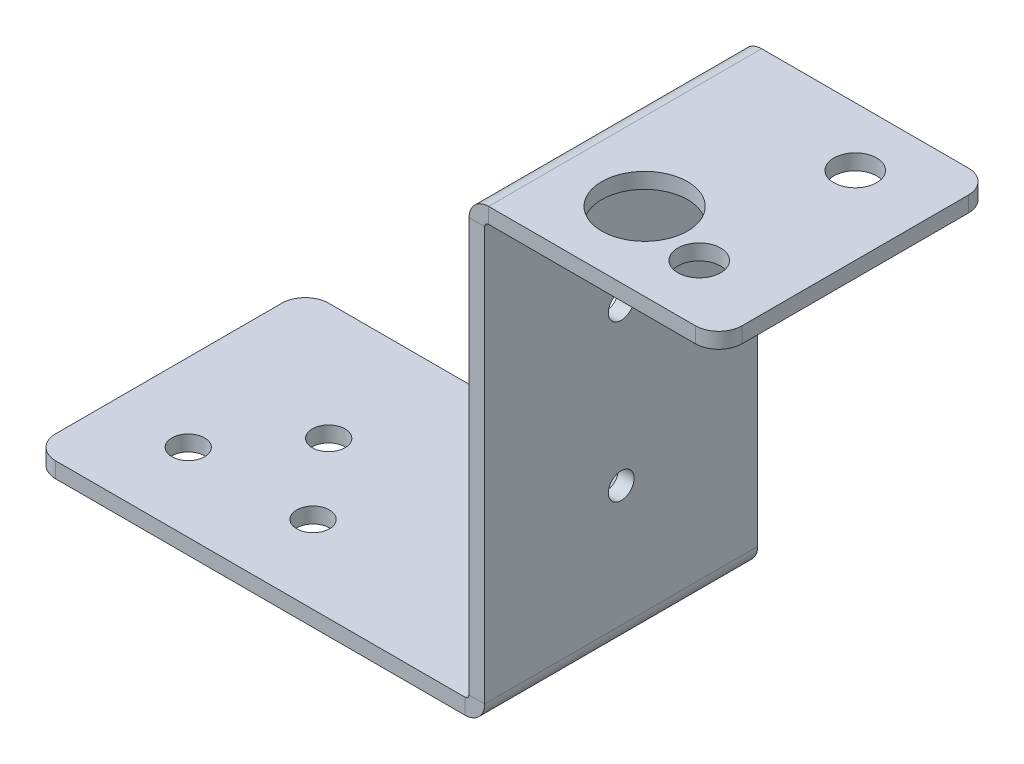
from build123d import *

# Parameters (mm, degrees)
EXTRUDE_1_DEPTH               = 35
FILLET_1_R                    = 3
CUT_EXTRUDE_2_DEPTH           = 310.2026821
CUT_EXTRUDE_2_DEPTH_BACK      = 310.2026821
SKETCH_5_R                    = 2.1
SKETCH_5_R_2                  = 5.5
SKETCH_5_R_3                  = 2.75
SKETCH_6_R                    = 1.65
CUT_EXTRUDE_3_DEPTH           = 35
SHEET_START                   = -667.695268107
SHEET_METAL_1_OUTLINE_R       = 2.75
SHEET_METAL_1_OUTLINE_R_2     = 5.5
SHEET_METAL_1_DEPTH           = 56
SHEET_START_2                 = -669.695268107
SHEET_METAL_1_2_OUTLINE_R     = 1.65
SHEET_METAL_1_2_OUTLINE_R_2   = 2.75
SHEET_METAL_1_2_OUTLINE_R_3   = 5.5
SHEET_METAL_1_2_DEPTH         = 2
SHEET_METAL_1_3_OUTLINE_R     = 1.65
SHEET_METAL_1_3_OUTLINE_R_2   = 2.75
SHEET_METAL_1_3_OUTLINE_R_3   = 5.5
SHEET_METAL_1_3_DEPTH         = 2
SHEET_START_3                 = -650.045268007
SHEET_METAL_1_3_2_OUTLINE_W   = 2
SHEET_METAL_1_3_2_OUTLINE_H   = 35
SHEET_METAL_1_3_2_DEPTH       = 16.6999998
SHEET_START_4                 = -630.045268007
SHEET_METAL_1_3_3_OUTLINE_W   = 2
SHEET_METAL_1_3_3_OUTLINE_H   = 35
SHEET_METAL_1_3_3_DEPTH       = 15.8499999
SHEET_START_5                 = -667.459318107
SHEET_METAL_1_3_4_OUTLINE_W   = 2
SHEET_METAL_1_3_4_OUTLINE_H   = 35
SHEET_METAL_1_3_4_DEPTH       = 14.1140499
SHEET_START_6                 = -613.695268107
SHEET_METAL_1_3_5_OUTLINE_R   = 1.65
SHEET_METAL_1_3_5_DEPTH       = 2
SHEET_START_7                 = -614.195268107
SHEET_METAL_1_3_6_OUTLINE_R   = 5.5
SHEET_METAL_1_3_6_OUTLINE_R_2 = 2.75
SHEET_METAL_1_3_6_OUTLINE_R_3 = 1.65
SHEET_METAL_1_3_6_DEPTH       = 2.5
SHEET_START_8                 = -653.345268207
SHEET_METAL_1_3_7_OUTLINE_W   = 2
SHEET_METAL_1_3_7_OUTLINE_H   = 35
SHEET_METAL_1_3_7_DEPTH       = 23.3000002
SHEET_METAL_1_3_8_OUTLINE_W   = 2
SHEET_METAL_1_3_8_OUTLINE_H   = 35
SHEET_METAL_1_3_8_DEPTH       = 0.23595
SHEET_START_9                 = -35
SHEET_METAL_1_3_9_DEPTH       = 35
SHEET_START_10                = 269.690733397
SHEET_METAL_1_3_10_OUTLINE_R  = 1.65
SHEET_METAL_1_3_10_DEPTH      = 2
SHEET_METAL_1_3_11_DEPTH      = 35


with BuildPart() as part:
    # Sketch 2 → 凸台-拉伸1 (new body)
    with BuildSketch(Plane.XY):
        with BuildLine():
            Line((298.690733397, -611.695268107), (272.190733397, -611.695268107))
            ThreePointArc((272.190733397, -611.695268107), (270.422966444, -612.427501154), (269.690733397, -614.195268107))
            Line((269.690733397, -614.195268107), (269.690733397, -667.195268107))
            ThreePointArc((269.690733397, -667.195268107), (269.544286788, -667.548821498), (269.190733397, -667.695268107))
            Line((269.190733397, -667.695268107), (216.690733397, -667.695268107))
            Line((216.690733397, -667.695268107), (213.690733397, -667.695268107))
            Line((213.690733397, -667.695268107), (213.690733397, -669.695268107))
            Line((213.690733397, -669.695268107), (216.690733397, -669.695268107))
            Line((216.690733397, -669.695268107), (269.190733397, -669.695268107))
            ThreePointArc((269.190733397, -669.695268107), (270.95850035, -668.96303506), (271.690733397, -667.195268107))
            Line((271.690733397, -667.195268107), (271.690733397, -614.195268107))
            ThreePointArc((271.690733397, -614.195268107), (271.837180006, -613.841714717), (272.190733397, -613.695268107))
            Line((272.190733397, -613.695268107), (298.690733397, -613.695268107))
            Line((298.690733397, -613.695268107), (301.690733397, -613.695268107))
            Line((301.690733397, -613.695268107), (301.690733397, -611.695268107))
            Line((301.690733397, -611.695268107), (298.690733397, -611.695268107))
        make_face()
    extrude(amount=-EXTRUDE_1_DEPTH)

    # 圆角1
    fillet_1_edges = [part.edges().sort_by_distance(p)[0] for p in [
        (301.690733397, -612.695268107, -35),
        (213.690733397, -668.695268107, 0),
        (301.690733397, -612.695268107, 0),
        (213.690733397, -668.695268107, -35),
    ]]
    fillet(fillet_1_edges, radius=FILLET_1_R)

    # 草图5 → 切除-拉伸2 (cut, two sides: drawn at the far end of the back side and taken through both)
    with BuildSketch(Plane.XZ.offset(669.695268107).offset(-CUT_EXTRUDE_2_DEPTH_BACK)):
        with Locations(Location((223.690733397, -10, 0), (0, 0, 270))):
            Circle(SKETCH_5_R)
        with Locations(Location((239.690733397, -10, 0), (0, 0, 270))):
            Circle(SKETCH_5_R)
        with Locations(Location((231.690733397, -20, 0), (0, 0, 270))):
            Circle(SKETCH_5_R)
        with Locations(Location((282.190733397, -10, 0), (0, 0, 270))):
            Circle(SKETCH_5_R_2)
        with Locations(Location((291.690733397, -7.5, 0), (0, 0, 270))):
            Circle(SKETCH_5_R_3)
        with Locations(Location((291.690733397, -27.5, 0), (0, 0, 270))):
            Circle(SKETCH_5_R_3)
    extrude(amount=CUT_EXTRUDE_2_DEPTH + CUT_EXTRUDE_2_DEPTH_BACK, mode=Mode.SUBTRACT)

    # 草图6 → 切除-拉伸3 (cut)
    with BuildSketch(Plane.ZY.offset(-269.690733397)):
        with Locations(Location((-17.5, -651.695268107, 0), (0, 0, 270))):
            Circle(SKETCH_6_R)
        with Locations(Location((-17.5, -631.695268107, 0), (0, 0, 270))):
            Circle(SKETCH_6_R)
    extrude(amount=-CUT_EXTRUDE_3_DEPTH, mode=Mode.SUBTRACT)

    # Sheet Metal 1: read off the stored shape, not the designer's step
    # Sheet Metal 1 outline → Sheet Metal 1 (cut)
    with BuildSketch(Plane(origin=(0, 0, 0), x_dir=(1, 0, 0), z_dir=(0, 1, 0)).offset(SHEET_START)):
        with BuildLine():
            ThreePointArc((298.690733397, 0), (300.812053741, 0.878679656), (301.690733397, 3))
            Line((301.690733397, 3), (301.690733397, 32))
            ThreePointArc((301.690733397, 32), (300.812053741, 34.121320344), (298.690733397, 35))
            Line((298.690733397, 35), (269.190733397, 35))
            Line((269.190733397, 35), (269.190733397, 0))
            Line((269.190733397, 0), (298.690733397, 0))
        make_face()
        with Locations((291.690733397, 7.5)):
            Circle(SHEET_METAL_1_OUTLINE_R, mode=Mode.SUBTRACT)
        with Locations((282.190733397, 10)):
            Circle(SHEET_METAL_1_OUTLINE_R_2, mode=Mode.SUBTRACT)
        with Locations((291.690733397, 27.5)):
            Circle(SHEET_METAL_1_OUTLINE_R, mode=Mode.SUBTRACT)
    extrude(amount=SHEET_METAL_1_DEPTH, mode=Mode.SUBTRACT)

    # Sheet Metal 1 2 outline → Sheet Metal 1 2 (add)
    with BuildSketch(Plane(origin=(0, 0, 0), x_dir=(1, 0, 0), z_dir=(0, 1, 0)).offset(SHEET_START_2)):
        with BuildLine():
            ThreePointArc((351.890733397, 0), (354.012053741, 0.878679656), (354.890733397, 3))
            Line((354.890733397, 3), (354.890733397, 32))
            ThreePointArc((354.890733397, 32), (354.012053741, 34.121320344), (351.890733397, 35))
            Line((351.890733397, 35), (269.190733397, 35))
            Line((269.190733397, 35), (269.190733397, 0))
            Line((269.190733397, 0), (351.890733397, 0))
        make_face()
        with Locations((306.290733397, 17.5)):
            Circle(SHEET_METAL_1_2_OUTLINE_R, mode=Mode.SUBTRACT)
        with Locations((286.290733397, 17.5)):
            Circle(SHEET_METAL_1_2_OUTLINE_R, mode=Mode.SUBTRACT)
        with Locations((344.890733397, 27.5)):
            Circle(SHEET_METAL_1_2_OUTLINE_R_2, mode=Mode.SUBTRACT)
        with Locations((344.890733397, 7.5)):
            Circle(SHEET_METAL_1_2_OUTLINE_R_2, mode=Mode.SUBTRACT)
        with Locations((335.390733397, 10)):
            Circle(SHEET_METAL_1_2_OUTLINE_R_3, mode=Mode.SUBTRACT)
    extrude(amount=SHEET_METAL_1_2_DEPTH)

    # Sheet Metal 1 3: read off the stored shape, not the designer's step
    # Sheet Metal 1 3 outline → Sheet Metal 1 3 (cut)
    with BuildSketch(Plane(origin=(0, 0, 0), x_dir=(1, 0, 0), z_dir=(0, 1, 0)).offset(SHEET_START_2)):
        with BuildLine():
            ThreePointArc((351.890733397, 0), (354.012053741, 0.878679656), (354.890733397, 3))
            Line((354.890733397, 3), (354.890733397, 32))
            ThreePointArc((354.890733397, 32), (354.012053741, 34.121320344), (351.890733397, 35))
            Line((351.890733397, 35), (271.690733397, 35))
            Line((271.690733397, 35), (271.690733397, 0))
            Line((271.690733397, 0), (351.890733397, 0))
        make_face()
        with Locations((286.290733397, 17.5)):
            Circle(SHEET_METAL_1_3_OUTLINE_R, mode=Mode.SUBTRACT)
        with Locations((344.890733397, 7.5)):
            Circle(SHEET_METAL_1_3_OUTLINE_R_2, mode=Mode.SUBTRACT)
        with Locations((335.390733397, 10)):
            Circle(SHEET_METAL_1_3_OUTLINE_R_3, mode=Mode.SUBTRACT)
        with Locations((344.890733397, 27.5)):
            Circle(SHEET_METAL_1_3_OUTLINE_R_2, mode=Mode.SUBTRACT)
        with Locations((306.290733397, 17.5)):
            Circle(SHEET_METAL_1_3_OUTLINE_R, mode=Mode.SUBTRACT)
    extrude(amount=SHEET_METAL_1_3_DEPTH, mode=Mode.SUBTRACT)



with BuildPart() as body_2:
    # Sheet Metal 1 3 2 outline → Sheet Metal 1 3 2 (new body)
    with BuildSketch(Plane(origin=(0, 0, 0), x_dir=(1, 0, 0), z_dir=(0, 1, 0)).offset(SHEET_START_3)):
        with Locations((270.690733397, 17.5)):
            Rectangle(SHEET_METAL_1_3_2_OUTLINE_W, SHEET_METAL_1_3_2_OUTLINE_H)
    extrude(amount=SHEET_METAL_1_3_2_DEPTH)



with BuildPart() as body_3:
    # Sheet Metal 1 3 3 outline → Sheet Metal 1 3 3 (new body)
    with BuildSketch(Plane(origin=(0, 0, 0), x_dir=(1, 0, 0), z_dir=(0, 1, 0)).offset(SHEET_START_4)):
        with Locations((270.690733397, 17.5)):
            Rectangle(SHEET_METAL_1_3_3_OUTLINE_W, SHEET_METAL_1_3_3_OUTLINE_H)
    extrude(amount=SHEET_METAL_1_3_3_DEPTH)



with BuildPart() as body_4:
    # Sheet Metal 1 3 4 outline → Sheet Metal 1 3 4 (new body)
    with BuildSketch(Plane(origin=(0, 0, 0), x_dir=(1, 0, 0), z_dir=(0, 1, 0)).offset(SHEET_START_5)):
        with Locations((270.690733397, 17.5)):
            Rectangle(SHEET_METAL_1_3_4_OUTLINE_W, SHEET_METAL_1_3_4_OUTLINE_H)
    extrude(amount=SHEET_METAL_1_3_4_DEPTH)


with BuildPart() as body_5:
    # Sheet Metal 1 3 5 outline → Sheet Metal 1 3 5 (new body)
    with BuildSketch(Plane(origin=(0, 0, 0), x_dir=(1, 0, 0), z_dir=(0, 1, 0)).offset(SHEET_START_6)):
        with Locations((286.290733397, 17.5)):
            Circle(SHEET_METAL_1_3_5_OUTLINE_R)
    extrude(amount=SHEET_METAL_1_3_5_DEPTH)


with BuildPart() as body_3_1:
    add(body_3.part)

    add(body_5.part)  # Sheet Metal 1 3 6 merges body 5
    # Sheet Metal 1 3 6 outline → Sheet Metal 1 3 6 (add)
    with BuildSketch(Plane(origin=(0, 0, 0), x_dir=(1, 0, 0), z_dir=(0, 1, 0)).offset(SHEET_START_7)):
        with BuildLine():
            ThreePointArc((298.690733397, 0), (300.812053741, 0.878679656), (301.690733397, 3))
            Line((301.690733397, 3), (301.690733397, 32))
            ThreePointArc((301.690733397, 32), (300.812053741, 34.121320344), (298.690733397, 35))
            Line((298.690733397, 35), (269.690733397, 35))
            Line((269.690733397, 35), (269.690733397, 0))
            Line((269.690733397, 0), (298.690733397, 0))
        make_face()
        with Locations((282.190733397, 10)):
            Circle(SHEET_METAL_1_3_6_OUTLINE_R, mode=Mode.SUBTRACT)
        with Locations((291.690733397, 7.5)):
            Circle(SHEET_METAL_1_3_6_OUTLINE_R_2, mode=Mode.SUBTRACT)
        with Locations((286.290733397, 17.5)):
            Circle(SHEET_METAL_1_3_6_OUTLINE_R_3, mode=Mode.SUBTRACT)
        with Locations((291.690733397, 27.5)):
            Circle(SHEET_METAL_1_3_6_OUTLINE_R_2, mode=Mode.SUBTRACT)
    extrude(amount=SHEET_METAL_1_3_6_DEPTH)


with BuildPart() as body_2_1:
    add(body_2.part)

    add(body_3_1.part)  # Sheet Metal 1 3 7 merges body 3

    add(body_4.part)  # Sheet Metal 1 3 7 merges body 4
    # Sheet Metal 1 3 7 outline → Sheet Metal 1 3 7 (add)
    with BuildSketch(Plane(origin=(0, 0, 0), x_dir=(1, 0, 0), z_dir=(0, 1, 0)).offset(SHEET_START_8)):
        with Locations((270.690733397, 17.5)):
            Rectangle(SHEET_METAL_1_3_7_OUTLINE_W, SHEET_METAL_1_3_7_OUTLINE_H)
    extrude(amount=SHEET_METAL_1_3_7_DEPTH)


with BuildPart() as part_1:
    add(part.part)

    add(body_2_1.part)  # Sheet Metal 1 3 8 merges body 2
    # Sheet Metal 1 3 8 outline → Sheet Metal 1 3 8 (add)
    with BuildSketch(Plane(origin=(0, 0, 0), x_dir=(1, 0, 0), z_dir=(0, 1, 0)).offset(SHEET_START)):
        with Locations((270.690733397, 17.5)):
            Rectangle(SHEET_METAL_1_3_8_OUTLINE_W, SHEET_METAL_1_3_8_OUTLINE_H)
    extrude(amount=SHEET_METAL_1_3_8_DEPTH)

    # Sheet Metal 1 3 9 outline → Sheet Metal 1 3 9 (add)
    with BuildSketch(Plane.XY.offset(SHEET_START_9)):
        with BuildLine():
            Line((269.690733397, -667.695268107), (269.690733397, -667.195268107))
            ThreePointArc((269.690733397, -667.195268107), (269.544286788, -667.548821498), (269.190733397, -667.695268107))
            Line((269.190733397, -667.695268107), (269.690733397, -667.695268107))
        make_face()
    extrude(amount=SHEET_METAL_1_3_9_DEPTH)

    # Sheet Metal 1 3 10 outline → Sheet Metal 1 3 10 (cut)
    with BuildSketch(Plane.YZ.offset(SHEET_START_10)):
        with Locations((-631.695268107, -17.5)):
            Circle(SHEET_METAL_1_3_10_OUTLINE_R)
        with Locations((-651.695268107, -17.5)):
            Circle(SHEET_METAL_1_3_10_OUTLINE_R)
    extrude(amount=SHEET_METAL_1_3_10_DEPTH, mode=Mode.SUBTRACT)

    # Sheet Metal 1 3 11 outline → Sheet Metal 1 3 11 (cut)
    with BuildSketch(Plane.XY.offset(SHEET_START_9)):
        with BuildLine():
            Line((271.690733397, -669.695268107), (271.690733397, -667.195268107))
            ThreePointArc((271.690733397, -667.195268107), (270.95850035, -668.96303506), (269.190733397, -669.695268107))
            Line((269.190733397, -669.695268107), (271.690733397, -669.695268107))
        make_face()
        with BuildLine():
            ThreePointArc((269.690733397, -614.195268107), (270.422966444, -612.427501154), (272.190733397, -611.695268107))
            Line((272.190733397, -611.695268107), (269.690733397, -611.695268107))
            Line((269.690733397, -611.695268107), (269.690733397, -614.195268107))
        make_face()
        with BuildLine():
            ThreePointArc((272.190733397, -613.695268107), (271.837180006, -613.841714716), (271.690733397, -614.195268107))
            Line((271.690733397, -614.195268107), (301.690733397, -614.195268107))
            Line((301.690733397, -614.195268107), (301.690733397, -613.695268107))
            Line((301.690733397, -613.695268107), (272.190733397, -613.695268107))
        make_face()
    extrude(amount=SHEET_METAL_1_3_11_DEPTH, mode=Mode.SUBTRACT)


solid = part_1.part
